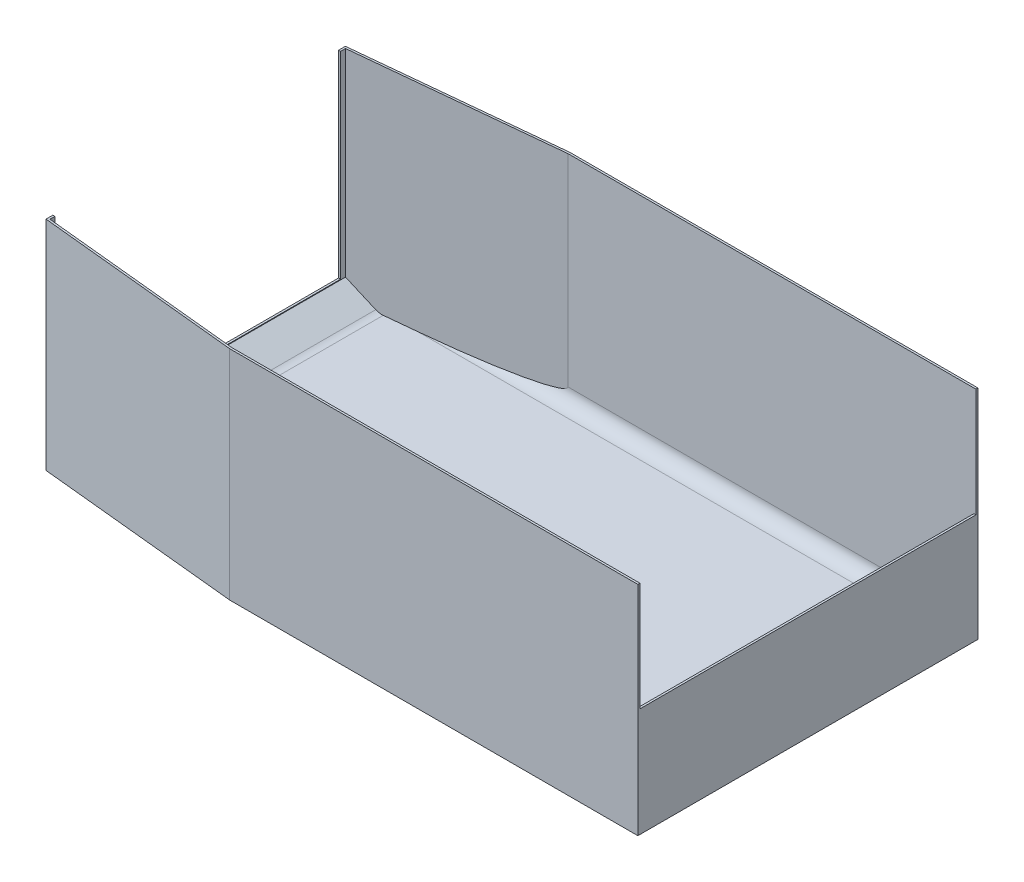
from build123d import *

# Parameters (mm, degrees)
EXTRUDE_1_DEPTH     = 160
SHELL_1_T           = -1.5
SKETCH_2_W          = 210
SKETCH_2_H          = 185
CUT_EXTRUDE_1_DEPTH = 200
CHAMFER_1_SIZE      = 13
CHAMFER_1_SIZE2     = 22.516660498
SKETCH_6_W          = 247
SKETCH_6_H          = 80
CUT_EXTRUDE_2_DEPTH = 200
FILLET_1_R          = 10
FILLET_2_R          = 10


with BuildPart() as part:
    # 草图1 → 凸台-拉伸1 (new body)
    with BuildSketch(Plane(origin=(0, 0, 0), x_dir=(1, 0, 0), z_dir=(0, 1, 0))):
        Polygon((-150, 125), (150, 125), (150, -125), (-150, -125), (-300, -110), (-300, 110), align=None)
    extrude(amount=EXTRUDE_1_DEPTH)

    # 抽壳1
    shell_1_openings = [part.faces().sort_by_distance(p)[0] for p in [
        (-71.428571429, 160, 0),
    ]]
    offset(amount=SHELL_1_T, openings=shell_1_openings, kind=Kind.INTERSECTION)

    # 草图2 → 切除-拉伸1 (cut)
    with BuildSketch(Plane.ZY.offset(300)):
        with Locations((0, 107.5)):
            Rectangle(SKETCH_2_W, SKETCH_2_H)
    extrude(amount=-CUT_EXTRUDE_1_DEPTH, mode=Mode.SUBTRACT)

    # 倒角1
    chamfer_1_edges = [part.edges().sort_by_distance(p)[0] for p in [
        (-298.5, 1.5, 0),
    ]]
    chamfer_1_side = [part.faces().sort_by_distance(p)[0] for p in [
        (-298.5, 80.75, 105.953001276),
    ]]
    chamfer(chamfer_1_edges, length=CHAMFER_1_SIZE, length2=CHAMFER_1_SIZE2, reference=chamfer_1_side[0])

    # 草图6 → 切除-拉伸2 (cut)
    with BuildSketch(Plane(origin=(150, 0, 0), x_dir=(0, 0, -1), z_dir=(1, 0, 0))):
        with Locations((0, 120)):
            Rectangle(SKETCH_6_W, SKETCH_6_H)
    extrude(amount=-CUT_EXTRUDE_2_DEPTH, mode=Mode.SUBTRACT)

    # 圆角1
    fillet_1_edges = [part.edges().sort_by_distance(p)[0] for p in [
        (-275.983339502, 1.5, 0),
    ]]
    fillet(fillet_1_edges, radius=FILLET_1_R)

    # 圆角2
    # the kernel refuses this fillet: 10 mm, written as the material it adds along each edge
    with BuildSketch(Plane(origin=(148.5, 1.5, -123.5), x_dir=(0, 0, 1), z_dir=(-1, 0, 0))) as fillet_2_piece_1_section:
        with BuildLine():
            CenterArc((FILLET_2_R, FILLET_2_R), FILLET_2_R, 180, 90)
            Line((0, FILLET_2_R), (0, 0))
            Line((0, 0), (FILLET_2_R, 0))
        make_face()
    fillet_2_piece_1 = extrude(amount=423.425186568, mode=Mode.PRIVATE)
    fillet_2_piece_1 = split(fillet_2_piece_1, bisect_by=Plane(origin=(145.545295182, 1.5, -153.047048175), z_dir=(0.09950371902099917, 0, 0.9950371902099892)), keep=Keep.TOP, mode=Mode.PRIVATE)
    add(fillet_2_piece_1)
    with BuildSketch(Plane(origin=(-274.925186568, 1.5, 123.5), x_dir=(0, 0, -1), z_dir=(1, 0, 0))) as fillet_2_piece_2_section:
        with BuildLine():
            CenterArc((FILLET_2_R, FILLET_2_R), FILLET_2_R, 180, 90)
            Line((0, FILLET_2_R), (0, 0))
            Line((0, 0), (FILLET_2_R, 0))
        make_face()
    fillet_2_piece_2 = extrude(amount=423.425186568, mode=Mode.PRIVATE)
    fillet_2_piece_2 = split(fillet_2_piece_2, bisect_by=Plane(origin=(-273.687562806, 1.5, 111.123762376), z_dir=(0.09950371902099844, 0, -0.9950371902099893)), keep=Keep.TOP, mode=Mode.PRIVATE)
    add(fillet_2_piece_2)


solid = part.part
